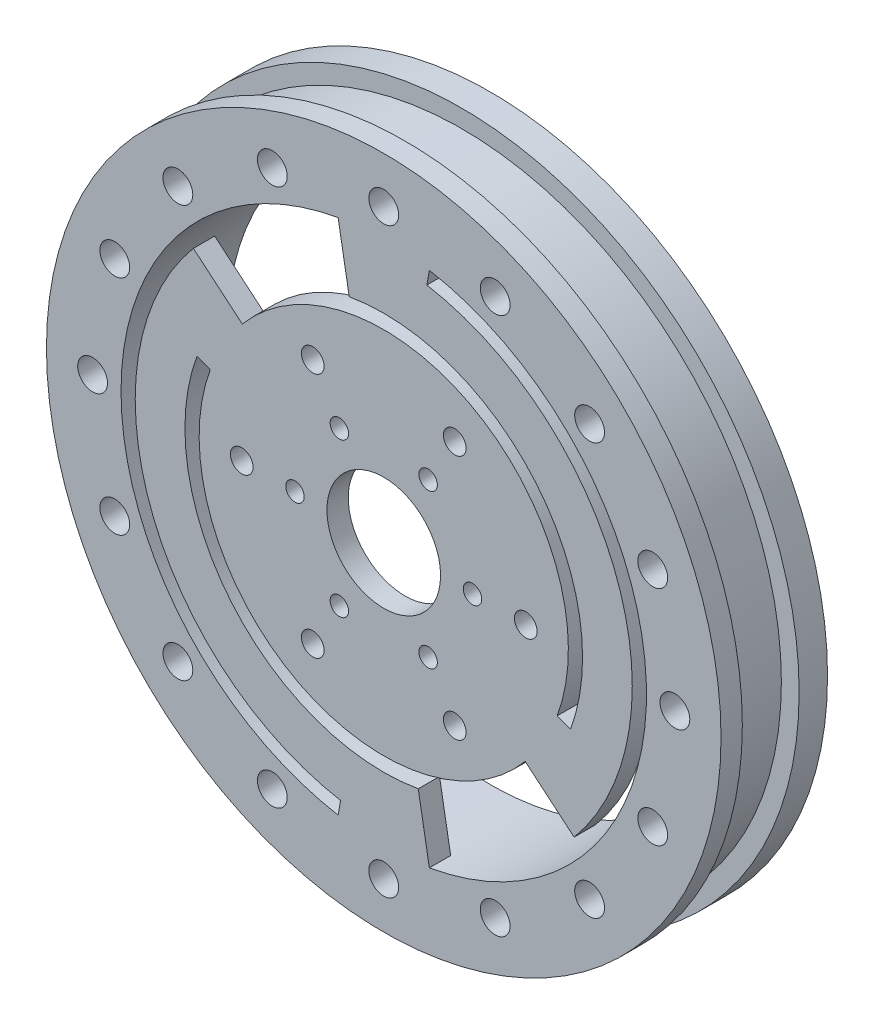
from build123d import *
from build123d.topology import SkipClean

# Parameters (mm, degrees)
SKETCH_1_R               = 45
SKETCH_1_R_2             = 37
EXTRUDE_1_DEPTH          = 8
EXTRUDE_START            = 4
SKETCH_2_R               = 47.5
SKETCH_2_R_2             = 37
EXTRUDE_2_DEPTH          = 4
EXTRUDE_START_2          = -8
SKETCH_2_2_R             = 47.5
SKETCH_2_2_R_2           = 37
EXTRUDE_5_DEPTH          = 3
CUT_EXTRUDE_1_DEPTH      = 69.82949949
CUT_EXTRUDE_1_DEPTH_BACK = 69.82949949
SKETCH_3_R               = 2.1
EXTRUDE_START_3          = 8
SKETCH_4_R               = 37
SKETCH_4_R_2             = 8
SKETCH_4_R_3             = 1.6
SKETCH_4_R_4             = 1.3
EXTRUDE_3_DEPTH          = 3
CUT_EXTRUDE_START        = 12
CUT_EXTRUDE_3_DEPTH      = 3
CUT_EXTRUDE_4_DEPTH      = 69.82949949
PATTERN_START            = 8
PATTERN_CIRCULAR_1_DEPTH = 3


# Read off the part's stored shape, not the designer's step: 切除-拉伸3, 阵列(圆周)1
with BuildPart() as part:
    # 草图1 → 凸台-拉伸1 (new body)
    with BuildSketch(Plane.XY):
        Circle(SKETCH_1_R)
        Circle(SKETCH_1_R_2, mode=Mode.SUBTRACT)
    extrude(amount=EXTRUDE_1_DEPTH)

    # 草图2 → 凸台-拉伸2 (add)
    with SkipClean():  # the faces are left unmerged after this step: merging them gives an invalid solid
        with BuildSketch(Plane(origin=(0, 0, 0), x_dir=(-1, 0, 0), z_dir=(0, 0, -1)).offset(EXTRUDE_START)):
            Circle(SKETCH_2_R)
            Circle(SKETCH_2_R_2, mode=Mode.SUBTRACT)
        extrude(amount=-EXTRUDE_2_DEPTH)

    # 草图2<2> → 凸台-拉伸5 (add)
    with BuildSketch(Plane(origin=(0, 0, 0), x_dir=(-1, 0, 0), z_dir=(0, 0, -1)).offset(EXTRUDE_START_2)):
        Circle(SKETCH_2_2_R)
        Circle(SKETCH_2_2_R_2, mode=Mode.SUBTRACT)
    extrude(amount=-EXTRUDE_5_DEPTH)

    # 草图3 → 切除-拉伸1 (cut, two sides: drawn at the far end of the back side and taken through both)
    with BuildSketch(Plane.XY.offset(11).offset(-CUT_EXTRUDE_1_DEPTH_BACK)):
        with Locations((0, 41)):
            Circle(SKETCH_3_R)
        with Locations((15.690020727, 37.879060833)):
            Circle(SKETCH_3_R)
        with Locations((28.991378029, 28.991378029)):
            Circle(SKETCH_3_R)
        with Locations((37.879060833, 15.690020727)):
            Circle(SKETCH_3_R)
        with Locations((41, 0)):
            Circle(SKETCH_3_R)
        with Locations((37.879060833, -15.690020727)):
            Circle(SKETCH_3_R)
        with Locations((28.991378029, -28.991378029)):
            Circle(SKETCH_3_R)
        with Locations((15.690020727, -37.879060833)):
            Circle(SKETCH_3_R)
        with Locations((0, -41)):
            Circle(SKETCH_3_R)
        with Locations((-15.690020727, -37.879060833)):
            Circle(SKETCH_3_R)
        with Locations((-28.991378029, -28.991378029)):
            Circle(SKETCH_3_R)
        with Locations((-37.879060833, -15.690020727)):
            Circle(SKETCH_3_R)
        with Locations((-41, 0)):
            Circle(SKETCH_3_R)
        with Locations((-37.879060833, 15.690020727)):
            Circle(SKETCH_3_R)
        with Locations((-28.991378029, 28.991378029)):
            Circle(SKETCH_3_R)
        with Locations((-15.690020727, 37.879060833)):
            Circle(SKETCH_3_R)
    extrude(amount=CUT_EXTRUDE_1_DEPTH + CUT_EXTRUDE_1_DEPTH_BACK, mode=Mode.SUBTRACT)

    # 草图4 → 凸台-拉伸3 (add)
    with BuildSketch(Plane.XY.offset(EXTRUDE_START_3)):
        with Locations(Location((0, 0, 0), (0, 0, 180))):
            Circle(SKETCH_4_R)
        Circle(SKETCH_4_R_2, mode=Mode.SUBTRACT)
        with Locations((20, 0)):
            Circle(SKETCH_4_R_3, mode=Mode.SUBTRACT)
        with Locations((10, -17.320508076)):
            Circle(SKETCH_4_R_3, mode=Mode.SUBTRACT)
        with Locations((-10, -17.320508076)):
            Circle(SKETCH_4_R_3, mode=Mode.SUBTRACT)
        with Locations((12.5, 0)):
            Circle(SKETCH_4_R_4, mode=Mode.SUBTRACT)
        with Locations((-20, 0)):
            Circle(SKETCH_4_R_3, mode=Mode.SUBTRACT)
        with Locations((-10, 17.320508076)):
            Circle(SKETCH_4_R_3, mode=Mode.SUBTRACT)
        with Locations((10, 17.320508076)):
            Circle(SKETCH_4_R_3, mode=Mode.SUBTRACT)
        with Locations((6.25, -10.825317547)):
            Circle(SKETCH_4_R_4, mode=Mode.SUBTRACT)
        with Locations((-6.25, -10.825317547)):
            Circle(SKETCH_4_R_4, mode=Mode.SUBTRACT)
        with Locations((-12.5, 0)):
            Circle(SKETCH_4_R_4, mode=Mode.SUBTRACT)
        with Locations((-6.25, 10.825317547)):
            Circle(SKETCH_4_R_4, mode=Mode.SUBTRACT)
        with Locations((6.25, 10.825317547)):
            Circle(SKETCH_4_R_4, mode=Mode.SUBTRACT)
    extrude(amount=EXTRUDE_3_DEPTH)

    # 切除-拉伸3 outline → 切除-拉伸3 (cut)
    with BuildSketch(Plane.XY.offset(-4).offset(CUT_EXTRUDE_START)):
        with BuildLine():
            Line((-4.514852619, 25.605001578), (-6.424982574, 36.437886861))
            ThreePointArc((-6.424982574, 36.437886861), (-18.5, 32.04293994), (-28.343644395, 23.783141558))
            Line((-28.343644395, 23.783141558), (-19.917155521, 16.712477852))
            ThreePointArc((-19.917155521, 16.712477852), (-13, 22.516660498), (-4.514852619, 25.605001578))
        make_face()
        with BuildLine():
            ThreePointArc((6.424982574, -36.437886861), (18.5, -32.04293994), (28.343644395, -23.783141558))
            Line((28.343644395, -23.783141558), (19.917155521, -16.712477852))
            ThreePointArc((19.917155521, -16.712477852), (13, -22.516660498), (4.514852619, -25.605001578))
            Line((4.514852619, -25.605001578), (6.424982574, -36.437886861))
        make_face()
    extrude(amount=CUT_EXTRUDE_3_DEPTH, mode=Mode.SUBTRACT)

    # 草图8 → Cut-Extrude 4 (cut, through all)
    with BuildSketch(Plane.XY.offset(11)):
        with BuildLine():
            ThreePointArc((4.514852619, -25.605001578), (-19.917155521, -16.712477852), (-24.43200814, 8.892523726))
            Line((-24.43200814, 8.892523726), (-26.311393382, 9.576564013))
            ThreePointArc((-26.311393382, 9.576564013), (-21.449244407, -17.998053071), (4.862148975, -27.574617084))
            Line((4.862148975, -27.574617084), (4.514852619, -25.605001578))
        make_face()
        with BuildLine():
            ThreePointArc((-28.343644395, 23.783141558), (-34.768626969, -12.654745303), (-6.424982574, -36.437886861))
            Line((-6.424982574, -36.437886861), (-6.077686218, -34.468271355))
            ThreePointArc((-6.077686218, -34.468271355), (-32.889241728, -11.970705016), (-26.811555509, 22.497566339))
            Line((-26.811555509, 22.497566339), (-28.343644395, 23.783141558))
        make_face()
    extrude(amount=-CUT_EXTRUDE_4_DEPTH, mode=Mode.SUBTRACT)


with BuildPart() as cut_extrude_4_kept_piece:
    # of the separate pieces the step leaves, the one the design keeps (cut_extrude_4_pieces_kept)
    add(part.part.solids().sort_by_distance((45, 0, 8))[0])

    # 阵列(圆周)1 outline → 阵列(圆周)1 (cut)
    with BuildSketch(Plane.XY.offset(PATTERN_START)):
        with BuildLine():
            ThreePointArc((28.343644395, -23.783141558), (34.768626969, 12.654745303), (6.424982574, 36.437886861))
            Line((6.424982574, 36.437886861), (6.077686218, 34.468271355))
            ThreePointArc((6.077686218, 34.468271355), (32.889241728, 11.970705017), (26.811555509, -22.497566339))
            Line((26.811555509, -22.497566339), (28.343644395, -23.783141558))
        make_face()
        with BuildLine():
            ThreePointArc((26.311393382, -9.576564013), (21.449244407, 17.998053071), (-4.862148975, 27.574617084))
            Line((-4.862148975, 27.574617084), (-4.514852619, 25.605001578))
            ThreePointArc((-4.514852619, 25.605001578), (19.917155521, 16.712477852), (24.43200814, -8.892523726))
            Line((24.43200814, -8.892523726), (26.311393382, -9.576564013))
        make_face()
    extrude(amount=PATTERN_CIRCULAR_1_DEPTH, mode=Mode.SUBTRACT)


solid = cut_extrude_4_kept_piece.part
